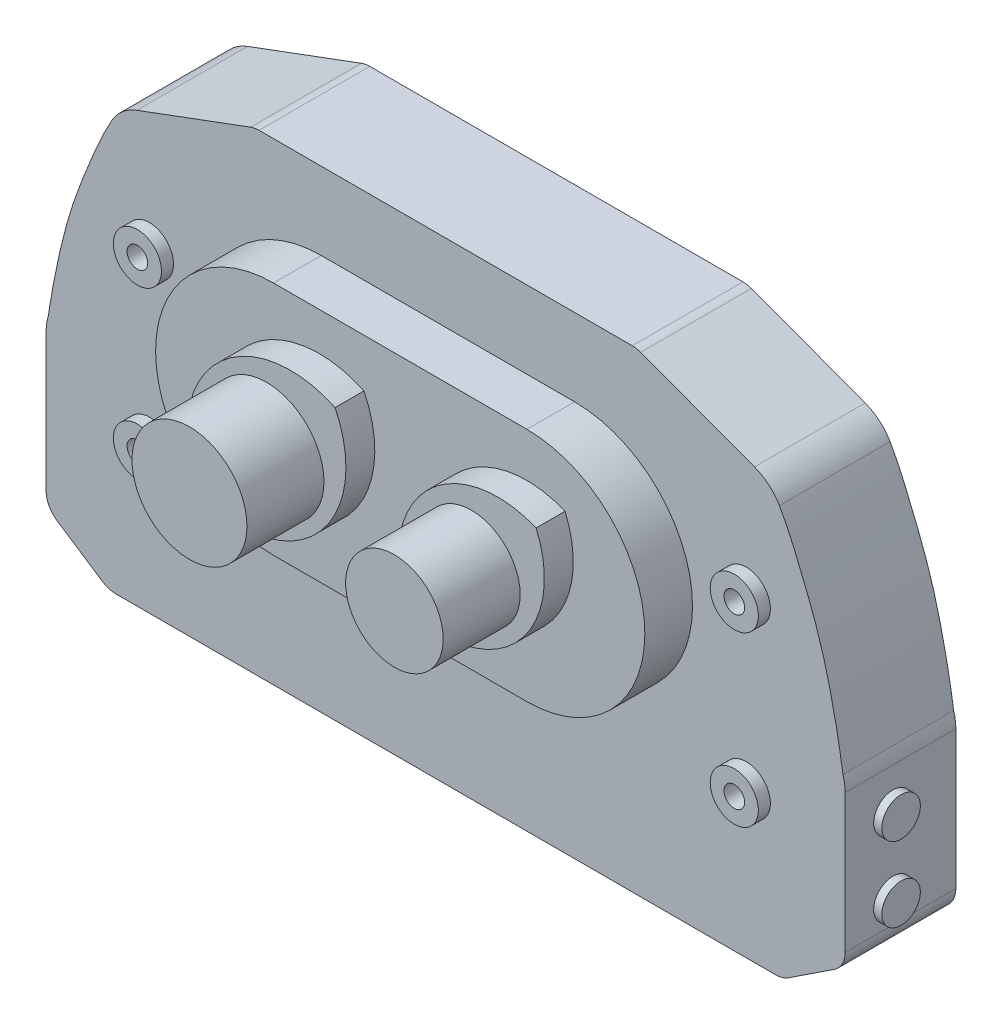
from build123d import *

# Parameters (mm, degrees)
BOSS_EXTRUDE1_DEPTH = 23
SKETCH5_R           = 4
BOSS_EXTRUDE3_DEPTH = 1.7
SKETCH8_R           = 4
BOSS_EXTRUDE4_DEPTH = 1.7
SKETCH12_R          = 5
BOSS_EXTRUDE5_DEPTH = 9.9
BOSS_EXTRUDE6_DEPTH = 22
CUT_EXTRUDE1_START  = -16
SKETCH16_R          = 11.94
CUT_EXTRUDE1_DEPTH  = 16
CUT_EXTRUDE2_START  = -16
SKETCH17_R          = 10.13
CUT_EXTRUDE2_DEPTH  = 16
SKETCH18_R          = 5.309585237
CUT_EXTRUDE3_DEPTH  = 7.4
SKETCH19_R          = 5.383577716
CUT_EXTRUDE4_DEPTH  = 7.4
SKETCH20_R          = 5.444301549
CUT_EXTRUDE5_DEPTH  = 7.4
SKETCH21_R          = 5.290961271
CUT_EXTRUDE6_DEPTH  = 7.4
SKETCH22_R          = 2.15
CUT_EXTRUDE7_DEPTH  = 10


with BuildPart() as part:
    # Sketch2 → Boss-Extrude1 (new body)
    with BuildSketch(Plane.XY):
        with BuildLine():
            Line((70.523413182, -121.258597495), (80.001788964, -115.008475165))
            ThreePointArc((80.001788964, -115.008475165), (81.651709385, -113.204688447), (82.249297777, -110.834293536))
            Line((82.249297777, -110.834293536), (82.249297777, -82.060728072))
            ThreePointArc((82.249297777, -82.060728072), (82.132627635, -80.537642087), (81.785339594, -79.050095835))
            add(Edge.make_bspline(
                [(81.785339594, -79.050095835), (81.779550585, -79.03175941), (79.763594577, -64.21980724), (72.310783114, -44.632084365), (70.089271073, -39.87053002), (68.584818962, -37.26596578)],
                knots=[0.01010668, 0.01010668, 0.01010668, 0.01010668, 0.430228508, 0.512694162, 0.834763224, 0.834763224, 0.834763224, 0.834763224], degree=3))
            ThreePointArc((68.584818962, -37.26596578), (66.377835563, -34.627803803), (63.407507036, -32.893496223))
            Line((63.407507036, -32.893496223), (39.759590264, -24.109812278))
            ThreePointArc((39.759590264, -24.109812278), (38.90305511, -23.875770322), (38.018627658, -23.796927511))
            Line((38.018627658, -23.796927511), (-39.520032104, -23.796927511))
            ThreePointArc((-39.520032104, -23.796927511), (-40.404459556, -23.875770322), (-41.26099471, -24.109812278))
            Line((-41.26099471, -24.109812278), (-64.908911482, -32.893496223))
            ThreePointArc((-64.908911482, -32.893496223), (-67.879240009, -34.627803803), (-70.086223408, -37.26596578))
            add(Edge.make_bspline(
                [(-83.28674404, -79.050095835), (-83.280955031, -79.03175941), (-81.264999023, -64.21980724), (-73.81218756, -44.632084365), (-71.590675519, -39.87053002), (-70.086223408, -37.26596578)],
                knots=[0.01010668, 0.01010668, 0.01010668, 0.01010668, 0.430228508, 0.512694162, 0.834763224, 0.834763224, 0.834763224, 0.834763224], degree=3))
            ThreePointArc((-83.28674404, -79.050095835), (-83.634032081, -80.537642087), (-83.750702223, -82.060728072))
            Line((-83.750702223, -82.060728072), (-83.750702223, -110.834293536))
            ThreePointArc((-83.750702223, -110.834293536), (-83.153113831, -113.204688447), (-81.50319341, -115.008475165))
            Line((-81.50319341, -115.008475165), (-72.024817629, -121.258597495))
            ThreePointArc((-72.024817629, -121.258597495), (-70.709179228, -121.873513284), (-69.272326442, -122.084415867))
            Line((-69.272326442, -122.084415867), (67.770921996, -122.084415867))
            ThreePointArc((67.770921996, -122.084415867), (69.207774782, -121.873513284), (70.523413182, -121.258597495))
        make_face()
    extrude(amount=BOSS_EXTRUDE1_DEPTH)

    # Sketch5 → Boss-Extrude3 (add)
    with BuildSketch(Plane.ZY.offset(83.750702223)):
        with Locations((13.083649818, -90.551709518)):
            Circle(SKETCH5_R)
        with Locations((13.083649818, -106.069633318)):
            Circle(SKETCH5_R)
    extrude(amount=BOSS_EXTRUDE3_DEPTH)

    # Sketch8 → Boss-Extrude4 (add)
    with BuildSketch(Plane(origin=(82.249297777, 0, 0), x_dir=(0, 0, -1), z_dir=(1, 0, 0))):
        with Locations((-13.08, -90.550728072)):
            Circle(SKETCH8_R)
        with Locations((-13.08, -106.070728072)):
            Circle(SKETCH8_R)
    extrude(amount=BOSS_EXTRUDE4_DEPTH)

    # Sketch12 → Boss-Extrude5 (add)
    with BuildSketch(Plane.XY.offset(23)):
        with Locations((61.713760646, -56.784557501)):
            Circle(SKETCH12_R)
        with Locations((61.713760646, -91.784557501)):
            Circle(SKETCH12_R)
        with Locations((-62.286239354, -91.784557501)):
            Circle(SKETCH12_R)
        with Locations((-62.286239354, -56.784557501)):
            Circle(SKETCH12_R)
        with BuildLine():
            Line((26.03317791, -39.869637962), (-26.605656617, -39.869637962))
            ThreePointArc((-26.605656617, -39.869637962), (-51.105656617, -64.369637962), (-26.605656617, -88.869637962))
            Line((-26.605656617, -88.869637962), (26.03317791, -88.869637962))
            ThreePointArc((26.03317791, -88.869637962), (50.53317791, -64.369637962), (26.03317791, -39.869637962))
        make_face()
    extrude(amount=BOSS_EXTRUDE5_DEPTH)

    # Sketch15 → Boss-Extrude6 (add)
    with BuildSketch(Plane.XY.offset(32.9)):
        with BuildLine():
            ThreePointArc((-36.30694092, -78.897586955), (-32.416918561, -54.237740907), (-7.831564022, -49.901772358))
            ThreePointArc((-7.831564022, -49.901772358), (-11.721586381, -74.561618406), (-36.30694092, -78.897586955))
        make_face()
        with BuildLine():
            ThreePointArc((33.947027157, -50.665986501), (29.727203797, -73.404384895), (7.056950152, -77.976175614))
            ThreePointArc((7.056950152, -77.976175614), (11.276773512, -55.23777722), (33.947027157, -50.665986501))
        make_face()
    extrude(amount=BOSS_EXTRUDE6_DEPTH)

    # Sketch16 → Cut-Extrude1 (cut)
    with BuildSketch(Plane.XY.offset(54.9).offset(CUT_EXTRUDE1_START)):
        with BuildLine():
            ThreePointArc((-36.30694092, -78.897586955), (-32.416918561, -54.237740907), (-7.831564022, -49.901772358))
            ThreePointArc((-7.831564022, -49.901772358), (-11.721586381, -74.561618406), (-36.30694092, -78.897586955))
        make_face()
        with Locations((-22.069252471, -64.399679657)):
            Circle(SKETCH16_R, mode=Mode.SUBTRACT)
    extrude(amount=CUT_EXTRUDE1_DEPTH, mode=Mode.SUBTRACT)

    # Sketch17 → Cut-Extrude2 (cut)
    with BuildSketch(Plane.XY.offset(54.9).offset(CUT_EXTRUDE2_START)):
        with BuildLine():
            ThreePointArc((7.056950152, -77.976175614), (11.276773512, -55.23777722), (33.947027157, -50.665986501))
            ThreePointArc((33.947027157, -50.665986501), (29.727203797, -73.404384895), (7.056950152, -77.976175614))
        make_face()
        with Locations((20.501988655, -64.321081058)):
            Circle(SKETCH17_R, mode=Mode.SUBTRACT)
    extrude(amount=CUT_EXTRUDE2_DEPTH, mode=Mode.SUBTRACT)

    # Sketch18 → Cut-Extrude3 (cut)
    with BuildSketch(Plane.XY.offset(32.9)):
        with Locations((61.713760646, -56.784557501)):
            Circle(SKETCH18_R)
    extrude(amount=-CUT_EXTRUDE3_DEPTH, mode=Mode.SUBTRACT)

    # Sketch19 → Cut-Extrude4 (cut)
    with BuildSketch(Plane.XY.offset(32.9)):
        with Locations((61.713760646, -91.784557501)):
            Circle(SKETCH19_R)
    extrude(amount=-CUT_EXTRUDE4_DEPTH, mode=Mode.SUBTRACT)

    # Sketch20 → Cut-Extrude5 (cut)
    with BuildSketch(Plane.XY.offset(32.9)):
        with Locations((-62.286239354, -56.784557501)):
            Circle(SKETCH20_R)
    extrude(amount=-CUT_EXTRUDE5_DEPTH, mode=Mode.SUBTRACT)

    # Sketch21 → Cut-Extrude6 (cut)
    with BuildSketch(Plane.XY.offset(32.9)):
        with Locations((-62.286239354, -91.784557501)):
            Circle(SKETCH21_R)
    extrude(amount=-CUT_EXTRUDE6_DEPTH, mode=Mode.SUBTRACT)

    # Sketch22 → Cut-Extrude7 (cut)
    with BuildSketch(Plane.XY.offset(25.5)):
        with Locations((-62.286239354, -56.784557501)):
            Circle(SKETCH22_R)
        with Locations((-62.286239354, -91.784557501)):
            Circle(SKETCH22_R)
        with Locations((61.713760646, -91.784557501)):
            Circle(SKETCH22_R)
        with Locations((61.713760646, -56.784557501)):
            Circle(SKETCH22_R)
    extrude(amount=-CUT_EXTRUDE7_DEPTH, mode=Mode.SUBTRACT)


solid = part.part
